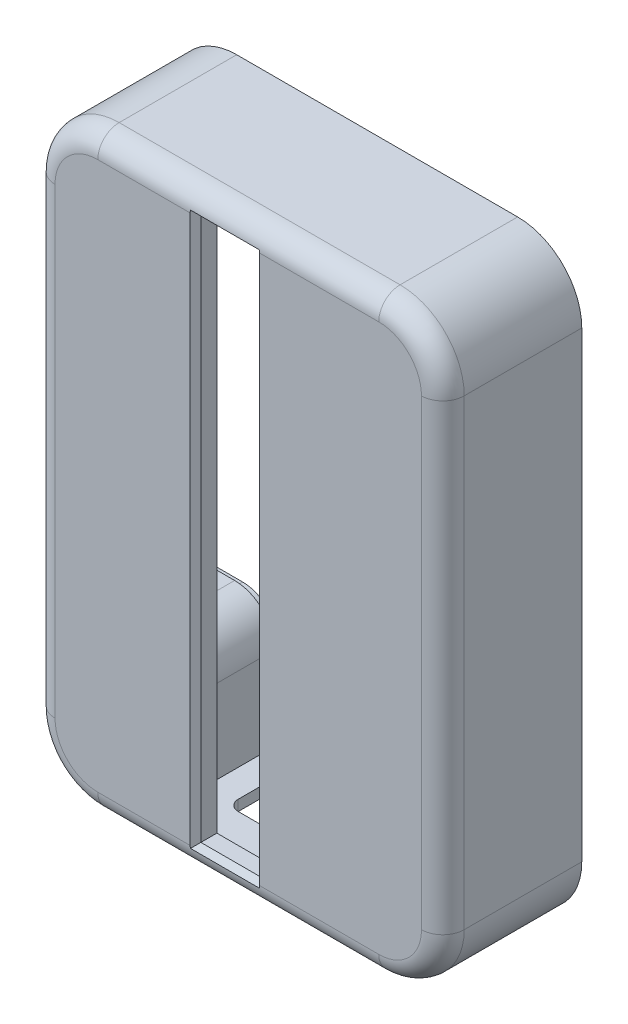
from build123d import *

# Parameters (mm, degrees)
BOSS_EXTRUDE1_DEPTH = 10
SKETCH12_W          = 1
SKETCH12_H          = 8.6
BOSS_EXTRUDE8_DEPTH = 5
BOSS_EXTRUDE5_DEPTH = 3
BOSS_EXTRUDE6_START = 10.75
SKETCH10_R          = 1.75
BOSS_EXTRUDE6_DEPTH = 10.75
SKETCH11_W          = 14.1
SKETCH11_H          = 1
BOSS_EXTRUDE7_DEPTH = 1.5
FILLET1_R           = 2
CUT_EXTRUDE2_REACH  = 69.377
SKETCH13_W          = 14
SKETCH13_H          = 7
FILLET2_R           = 1
SKETCH14_W          = 11
SKETCH14_H          = 53.26
CUT_EXTRUDE3_DEPTH  = 1
SKETCH15_W          = 5.5
SKETCH15_H          = 50.76
CUT_EXTRUDE4_DEPTH  = 64.095912704
SKETCH17_W          = 4
SKETCH17_H          = 5
SKETCH17_R          = 1
BOSS_EXTRUDE9_DEPTH = 1
CHAMFER1_SIZE       = 0.5
CUT_EXTRUDE5_START  = -1
SKETCH18_R          = 1
CUT_EXTRUDE5_DEPTH  = 1
CUT_EXTRUDE7_DEPTH  = 0.75


with BuildPart() as part:
    # Sketch1 → Boss-Extrude1 (new body)
    with BuildSketch(Plane.XY):
        with BuildLine():
            Line((-1, 27.44), (-1, 1))
            ThreePointArc((-1, 1), (0.464466094, -2.535533906), (4, -4))
            Line((4, -4), (30.29, -4))
            ThreePointArc((30.29, -4), (33.825533906, -2.535533906), (35.29, 1))
            Line((35.29, 1), (35.29, 44.26))
            ThreePointArc((35.29, 44.26), (33.825533906, 47.795533906), (30.29, 49.26))
            Line((30.29, 49.26), (4, 49.26))
            ThreePointArc((4, 49.26), (0.464466094, 47.795533906), (-1, 44.26))
            Line((-1, 44.26), (-1, 36.04))
            Line((-1, 36.04), (-2, 36.04))
            Line((-2, 36.04), (-2, 44.26))
            ThreePointArc((-2, 44.26), (-0.242640687, 48.502640687), (4, 50.26))
            Line((4, 50.26), (30.29, 50.26))
            ThreePointArc((30.29, 50.26), (34.532640687, 48.502640687), (36.29, 44.26))
            Line((36.29, 44.26), (36.29, 1))
            ThreePointArc((36.29, 1), (34.532640687, -3.242640687), (30.29, -5))
            Line((30.29, -5), (4, -5))
            ThreePointArc((4, -5), (-0.242640687, -3.242640687), (-2, 1))
            Line((-2, 1), (-2, 27.44))
            Line((-2, 27.44), (-1, 27.44))
        make_face()
    extrude(amount=BOSS_EXTRUDE1_DEPTH)

    # Sketch12 → Boss-Extrude8 (add)
    with BuildSketch(Plane.XY.offset(10)):
        with Locations((-1.5, 31.74)):
            Rectangle(SKETCH12_W, SKETCH12_H)
    extrude(amount=-BOSS_EXTRUDE8_DEPTH)

    # Sketch8 → Boss-Extrude5 (add)
    with BuildSketch(Plane.XY.offset(10)):
        with BuildLine():
            Line((-2, 44.26), (-2, 1))
            ThreePointArc((-2, 1), (-0.242640687, -3.242640687), (4, -5))
            Line((4, -5), (30.29, -5))
            ThreePointArc((30.29, -5), (34.532640687, -3.242640687), (36.29, 1))
            Line((36.29, 1), (36.29, 44.26))
            ThreePointArc((36.29, 44.26), (34.532640687, 48.502640687), (30.29, 50.26))
            Line((30.29, 50.26), (4, 50.26))
            ThreePointArc((4, 50.26), (-0.242640687, 48.502640687), (-2, 44.26))
        make_face()
    extrude(amount=BOSS_EXTRUDE5_DEPTH)

    # Sketch10 → Boss-Extrude6 (add)
    # profile 1 of 4: a face of its own
    with BuildSketch(Plane(origin=(0, 0, 10), x_dir=(-1, 0, 0), z_dir=(0, 0, -1)).offset(BOSS_EXTRUDE6_START)):
        with BuildLine():
            Line((-30.29, 49.26), (-26.73, 49.26))
            Line((-26.73, 49.26), (-26.73, 44.45))
            ThreePointArc((-26.73, 44.45), (-27.828349571, 41.798349571), (-30.48, 40.7))
            Line((-30.48, 40.7), (-35.29, 40.7))
            Line((-35.29, 40.7), (-35.29, 44.26))
            ThreePointArc((-35.29, 44.26), (-33.825533906, 47.795533906), (-30.29, 49.26))
        make_face()
        with Locations(Location((-30.48, 44.45, 0), (0, 0, 180))):
            Circle(SKETCH10_R, mode=Mode.SUBTRACT)
    # profile 2 of 4: a face of its own
    with BuildSketch(Plane(origin=(0, 0, 10), x_dir=(-1, 0, 0), z_dir=(0, 0, -1)).offset(BOSS_EXTRUDE6_START)):
        with BuildLine():
            Line((-3.81, 40.7), (1, 40.7))
            Line((1, 40.7), (1, 44.26))
            ThreePointArc((1, 44.26), (-0.464466094, 47.795533906), (-4, 49.26))
            Line((-4, 49.26), (-7.56, 49.26))
            Line((-7.56, 49.26), (-7.56, 44.45))
            ThreePointArc((-7.56, 44.45), (-6.461650429, 41.798349571), (-3.81, 40.7))
        make_face()
        with Locations(Location((-3.81, 44.45, 0), (0, 0, 180))):
            Circle(SKETCH10_R, mode=Mode.SUBTRACT)
    # profile 3 of 4: a face of its own
    with BuildSketch(Plane(origin=(0, 0, 10), x_dir=(-1, 0, 0), z_dir=(0, 0, -1)).offset(BOSS_EXTRUDE6_START)):
        with BuildLine():
            Line((1, 7.56), (1, 1))
            ThreePointArc((1, 1), (-0.464466094, -2.535533906), (-4, -4))
            Line((-4, -4), (-7.56, -4))
            Line((-7.56, -4), (-7.56, 3.81))
            ThreePointArc((-7.56, 3.81), (-6.461650429, 6.461650429), (-3.81, 7.56))
            Line((-3.81, 7.56), (1, 7.56))
        make_face()
        with Locations(Location((-3.81, 3.81, 0), (0, 0, 180))):
            Circle(SKETCH10_R, mode=Mode.SUBTRACT)
    # profile 4 of 4: a face of its own
    with BuildSketch(Plane(origin=(0, 0, 10), x_dir=(-1, 0, 0), z_dir=(0, 0, -1)).offset(BOSS_EXTRUDE6_START)):
        with BuildLine():
            Line((-26.73, -4), (-30.29, -4))
            ThreePointArc((-30.29, -4), (-33.825533906, -2.535533906), (-35.29, 1))
            Line((-35.29, 1), (-35.29, 7.56))
            Line((-35.29, 7.56), (-30.48, 7.56))
            ThreePointArc((-30.48, 7.56), (-27.828349571, 6.461650429), (-26.73, 3.81))
            Line((-26.73, 3.81), (-26.73, -4))
        make_face()
        with Locations(Location((-30.48, 3.81, 0), (0, 0, 180))):
            Circle(SKETCH10_R, mode=Mode.SUBTRACT)
    extrude(amount=-BOSS_EXTRUDE6_DEPTH)

    # Sketch11 → Boss-Extrude7 (add)
    with BuildSketch(Plane(origin=(0, 0, 10), x_dir=(-1, 0, 0), z_dir=(0, 0, -1))):
        with Locations((-17.145, -4.5)):
            Rectangle(SKETCH11_W, SKETCH11_H)
    extrude(amount=BOSS_EXTRUDE7_DEPTH)

    # Fillet1
    fillet1_edges = [part.edges().sort_by_distance(p)[0] for p in [
        (17.145, -5, 13),
        (36.29, 22.63, 13),
        (34.532640687, 48.502640687, 13),
        (17.145, 50.26, 13),
        (-0.242640687, 48.502640687, 13),
        (-2, 22.63, 13),
        (-0.242640687, -3.242640687, 13),
        (34.532640687, -3.242640687, 13),
    ]]
    fillet(fillet1_edges, radius=FILLET1_R)

    # Sketch13 → Cut-Extrude2 (cut, up to next)
    with BuildSketch(Plane.XZ.offset(5), mode=Mode.PRIVATE) as cut_extrude2_sk1:
        with Locations((17.145, 3.5)):
            Rectangle(SKETCH13_W, SKETCH13_H)
    cut_extrude2_tool1 = extrude(cut_extrude2_sk1.sketch, amount=-CUT_EXTRUDE2_REACH, mode=Mode.PRIVATE) & part.part
    add(cut_extrude2_tool1.solids().sort_by_distance((17.145, -5, 3.5))[0], mode=Mode.SUBTRACT)

    # Fillet2
    fillet2_edges = [part.edges().sort_by_distance(p)[0] for p in [
        (-1.5, 36.04, 5),
        (-1.5, 27.44, 5),
        (10.145, -4.5, 7),
        (24.145, -4.5, 7),
    ]]
    fillet(fillet2_edges, radius=FILLET2_R)

    # Sketch14 → Cut-Extrude3 (cut)
    with BuildSketch(Plane(origin=(0, 0, 10), x_dir=(-1, 0, 0), z_dir=(0, 0, -1))):
        with Locations((-17.145, 22.63)):
            Rectangle(SKETCH14_W, SKETCH14_H)
    extrude(amount=-CUT_EXTRUDE3_DEPTH, mode=Mode.SUBTRACT)

    # Sketch15 → Cut-Extrude4 (cut, through all)
    with BuildSketch(Plane(origin=(0, 0, 11), x_dir=(-1, 0, 0), z_dir=(0, 0, -1))):
        with Locations((-15.895, 22.63)):
            Rectangle(SKETCH15_W, SKETCH15_H)
    extrude(amount=-CUT_EXTRUDE4_DEPTH, mode=Mode.SUBTRACT)

    # Sketch17 → Boss-Extrude9 (add)
    # profile 1 of 2: a face of its own
    with BuildSketch(Plane(origin=(0, 0, 11), x_dir=(-1, 0, 0), z_dir=(0, 0, -1))):
        with Locations((-20.645, 10.36)):
            Rectangle(SKETCH17_W, SKETCH17_H)
        with Locations((-20.145, 10.36)):
            Circle(SKETCH17_R, mode=Mode.SUBTRACT)
    # profile 2 of 2: a face of its own
    with BuildSketch(Plane(origin=(0, 0, 11), x_dir=(-1, 0, 0), z_dir=(0, 0, -1))):
        with Locations((-20.645, 35.76)):
            Rectangle(SKETCH17_W, SKETCH17_H)
        with Locations((-20.145, 35.76)):
            Circle(SKETCH17_R, mode=Mode.SUBTRACT)
    extrude(amount=BOSS_EXTRUDE9_DEPTH)

    # Chamfer1
    # the kernel refuses this chamfer: 0.5 mm, written as the material it takes off along each edge
    with BuildSketch(Plane(origin=(13.145, 48.01, 13), x_dir=(-0.9996219169112968, 0, 0.027495876610585647), z_dir=(0, -1, 0)), Plane(origin=(18.645, -2.75, 13), x_dir=(0.9996219169112968, 0, 0.02749587661058555), z_dir=(0, 1, 0))) as chamfer1_piece_1:
        Polygon((CHAMFER1_SIZE * 0.999621916911, CHAMFER1_SIZE * 0.0274958766106), (-CHAMFER1_SIZE * 0.0274958766106, CHAMFER1_SIZE * 0.999621916911), (0, 0), align=None)
    extrude(amount=50.76, mode=Mode.SUBTRACT)
    with BuildSketch(Plane(origin=(13.145, -2.75, 13), x_dir=(0, -0.9996219169112968, 0.0274958766105856), z_dir=(1, 0, 0)), Plane(origin=(18.645, 48.01, 13), x_dir=(0, 0.9996219169112968, 0.02749587661058574), z_dir=(-1, 0, 0))) as chamfer1_piece_2:
        Polygon((CHAMFER1_SIZE * 0.999621916911, CHAMFER1_SIZE * 0.0274958766106), (-CHAMFER1_SIZE * 0.0274958766106, CHAMFER1_SIZE * 0.999621916911), (0, 0), align=None)
    extrude(amount=5.5, mode=Mode.SUBTRACT)
    with BuildSketch(Plane(origin=(18.645, 48.01, 13), x_dir=(0, 0.9996219169112968, 0.02749587661058574), z_dir=(-1, 0, 0))) as chamfer1_piece_3a_section:
        Polygon((CHAMFER1_SIZE * 0.999621916911, CHAMFER1_SIZE * 0.0274958766106), (-CHAMFER1_SIZE * 0.0274958766106, CHAMFER1_SIZE * 0.999621916911), (0, 0), align=None)
    chamfer1_piece_3a = extrude(amount=6.785841494, mode=Mode.PRIVATE)
    chamfer1_piece_3a = split(chamfer1_piece_3a, bisect_by=Plane(origin=(13.145, 48.174896813, 12.835103187), z_dir=(-1, 0, 0)), keep=Keep.TOP, mode=Mode.PRIVATE)
    with BuildSketch(Plane(origin=(13.145, 49.295841494, 13), x_dir=(-0.9996219169112968, 0, 0.027495876610585647), z_dir=(0, -1, 0))) as chamfer1_piece_3b_section:
        Polygon((CHAMFER1_SIZE * 0.999621916911, CHAMFER1_SIZE * 0.0274958766106), (-CHAMFER1_SIZE * 0.0274958766106, CHAMFER1_SIZE * 0.999621916911), (0, 0), align=None)
    chamfer1_piece_3b = extrude(amount=52.045841494, mode=Mode.PRIVATE)
    chamfer1_piece_3b = split(chamfer1_piece_3b, bisect_by=Plane(origin=(12.980103187, 48.01, 12.835103187), z_dir=(0, 1, 0)), keep=Keep.TOP, mode=Mode.PRIVATE)
    chamfer1_piece_3 = chamfer1_piece_3a & chamfer1_piece_3b
    add(chamfer1_piece_3, mode=Mode.SUBTRACT)
    with BuildSketch(Plane(origin=(13.145, 48.01, 13), x_dir=(-0.9996219169112968, 0, 0.027495876610585647), z_dir=(0, -1, 0))) as chamfer1_piece_4a_section:
        Polygon((CHAMFER1_SIZE * 0.999621916911, CHAMFER1_SIZE * 0.0274958766106), (-CHAMFER1_SIZE * 0.0274958766106, CHAMFER1_SIZE * 0.999621916911), (0, 0), align=None)
    chamfer1_piece_4a = extrude(amount=52.045841494, mode=Mode.PRIVATE)
    chamfer1_piece_4a = split(chamfer1_piece_4a, bisect_by=Plane(origin=(12.980103187, -2.75, 12.835103187), z_dir=(0, -1, 0)), keep=Keep.TOP, mode=Mode.PRIVATE)
    with BuildSketch(Plane(origin=(11.859158506, -2.75, 13), x_dir=(0, -0.9996219169112968, 0.027495876610585623), z_dir=(1, 0, 0))) as chamfer1_piece_4b_section:
        Polygon((CHAMFER1_SIZE * 0.999621916911, CHAMFER1_SIZE * 0.0274958766106), (-CHAMFER1_SIZE * 0.0274958766106, CHAMFER1_SIZE * 0.999621916911), (0, 0), align=None)
    chamfer1_piece_4b = extrude(amount=6.785841494, mode=Mode.PRIVATE)
    chamfer1_piece_4b = split(chamfer1_piece_4b, bisect_by=Plane(origin=(13.145, -2.914896813, 12.835103187), z_dir=(-1, 0, 0)), keep=Keep.TOP, mode=Mode.PRIVATE)
    chamfer1_piece_4 = chamfer1_piece_4a & chamfer1_piece_4b
    add(chamfer1_piece_4, mode=Mode.SUBTRACT)
    with BuildSketch(Plane(origin=(13.145, -2.75, 13), x_dir=(0, -0.9996219169112968, 0.0274958766105856), z_dir=(1, 0, 0))) as chamfer1_piece_5a_section:
        Polygon((CHAMFER1_SIZE * 0.999621916911, CHAMFER1_SIZE * 0.0274958766106), (-CHAMFER1_SIZE * 0.0274958766106, CHAMFER1_SIZE * 0.999621916911), (0, 0), align=None)
    chamfer1_piece_5a = extrude(amount=6.785841494, mode=Mode.PRIVATE)
    chamfer1_piece_5a = split(chamfer1_piece_5a, bisect_by=Plane(origin=(18.645, -2.914896813, 12.835103187), z_dir=(1, 0, 0)), keep=Keep.TOP, mode=Mode.PRIVATE)
    with BuildSketch(Plane(origin=(18.645, -4.035841494, 13), x_dir=(0.9996219169112968, 0, 0.02749587661058555), z_dir=(0, 1, 0))) as chamfer1_piece_5b_section:
        Polygon((CHAMFER1_SIZE * 0.999621916911, CHAMFER1_SIZE * 0.0274958766106), (-CHAMFER1_SIZE * 0.0274958766106, CHAMFER1_SIZE * 0.999621916911), (0, 0), align=None)
    chamfer1_piece_5b = extrude(amount=52.045841494, mode=Mode.PRIVATE)
    chamfer1_piece_5b = split(chamfer1_piece_5b, bisect_by=Plane(origin=(18.809896813, -2.75, 12.835103187), z_dir=(0, -1, 0)), keep=Keep.TOP, mode=Mode.PRIVATE)
    chamfer1_piece_5 = chamfer1_piece_5a & chamfer1_piece_5b
    add(chamfer1_piece_5, mode=Mode.SUBTRACT)
    with BuildSketch(Plane(origin=(19.930841494, 48.01, 13), x_dir=(0, 0.9996219169112968, 0.02749587661058574), z_dir=(-1, 0, 0))) as chamfer1_piece_6a_section:
        Polygon((CHAMFER1_SIZE * 0.999621916911, CHAMFER1_SIZE * 0.0274958766106), (-CHAMFER1_SIZE * 0.0274958766106, CHAMFER1_SIZE * 0.999621916911), (0, 0), align=None)
    chamfer1_piece_6a = extrude(amount=6.785841494, mode=Mode.PRIVATE)
    chamfer1_piece_6a = split(chamfer1_piece_6a, bisect_by=Plane(origin=(18.645, 48.174896813, 12.835103187), z_dir=(1, 0, 0)), keep=Keep.TOP, mode=Mode.PRIVATE)
    with BuildSketch(Plane(origin=(18.645, -2.75, 13), x_dir=(0.9996219169112968, 0, 0.02749587661058555), z_dir=(0, 1, 0))) as chamfer1_piece_6b_section:
        Polygon((CHAMFER1_SIZE * 0.999621916911, CHAMFER1_SIZE * 0.0274958766106), (-CHAMFER1_SIZE * 0.0274958766106, CHAMFER1_SIZE * 0.999621916911), (0, 0), align=None)
    chamfer1_piece_6b = extrude(amount=52.045841494, mode=Mode.PRIVATE)
    chamfer1_piece_6b = split(chamfer1_piece_6b, bisect_by=Plane(origin=(18.809896813, 48.01, 12.835103187), z_dir=(0, 1, 0)), keep=Keep.TOP, mode=Mode.PRIVATE)
    chamfer1_piece_6 = chamfer1_piece_6a & chamfer1_piece_6b
    add(chamfer1_piece_6, mode=Mode.SUBTRACT)

    # Sketch18 → Cut-Extrude5 (cut)
    with BuildSketch(Plane(origin=(0, 0, 11), x_dir=(-1, 0, 0), z_dir=(0, 0, -1)).offset(CUT_EXTRUDE5_START)):
        with Locations((-20.145, 10.36)):
            Circle(SKETCH18_R)
        with Locations((-20.145, 35.76)):
            Circle(SKETCH18_R)
    extrude(amount=CUT_EXTRUDE5_DEPTH, mode=Mode.SUBTRACT)

    # Sketch19 → Cut-Extrude7 (cut)
    # profile 1 of 4: a face of its own
    with BuildSketch(Plane(origin=(0, 0, -0.75), x_dir=(-1, 0, 0), z_dir=(0, 0, -1))):
        with BuildLine():
            Line((-25.23, 50.76), (-30.29, 50.76))
            ThreePointArc((-30.29, 50.76), (-34.886194078, 48.856194078), (-36.79, 44.26))
            Line((-36.79, 44.26), (-36.79, 39.2))
            Line((-36.79, 39.2), (-30.48, 39.2))
            ThreePointArc((-30.48, 39.2), (-26.767689399, 40.737689399), (-25.23, 44.45))
            Line((-25.23, 44.45), (-25.23, 50.76))
        make_face()
        with BuildLine():
            Line((-27.23, 48.76), (-30.29, 48.76))
            ThreePointArc((-30.29, 48.76), (-33.471980515, 47.441980515), (-34.79, 44.26))
            Line((-34.79, 44.26), (-34.79, 41.2))
            Line((-34.79, 41.2), (-30.48, 41.2))
            ThreePointArc((-30.48, 41.2), (-28.181902961, 42.151902961), (-27.23, 44.45))
            Line((-27.23, 44.45), (-27.23, 48.76))
        make_face(mode=Mode.SUBTRACT)
    # profile 2 of 4: a face of its own
    with BuildSketch(Plane(origin=(0, 0, -0.75), x_dir=(-1, 0, 0), z_dir=(0, 0, -1))):
        with BuildLine():
            Line((-4, 50.76), (-9.06, 50.76))
            Line((-9.06, 50.76), (-9.06, 44.45))
            ThreePointArc((-9.06, 44.45), (-7.522310601, 40.737689399), (-3.81, 39.2))
            Line((-3.81, 39.2), (2.5, 39.2))
            Line((2.5, 39.2), (2.5, 44.26))
            ThreePointArc((2.5, 44.26), (0.596194078, 48.856194078), (-4, 50.76))
        make_face()
        with BuildLine():
            Line((-4, 48.76), (-7.06, 48.76))
            Line((-7.06, 48.76), (-7.06, 44.45))
            ThreePointArc((-7.06, 44.45), (-6.108097039, 42.151902961), (-3.81, 41.2))
            Line((-3.81, 41.2), (0.5, 41.2))
            Line((0.5, 41.2), (0.5, 44.26))
            ThreePointArc((0.5, 44.26), (-0.818019485, 47.441980515), (-4, 48.76))
        make_face(mode=Mode.SUBTRACT)
    # profile 3 of 4: a face of its own
    with BuildSketch(Plane(origin=(0, 0, -0.75), x_dir=(-1, 0, 0), z_dir=(0, 0, -1))):
        with BuildLine():
            Line((-30.29, -5.5), (-25.23, -5.5))
            Line((-25.23, -5.5), (-25.23, 3.81))
            ThreePointArc((-25.23, 3.81), (-26.767689399, 7.522310601), (-30.48, 9.06))
            Line((-30.48, 9.06), (-36.79, 9.06))
            Line((-36.79, 9.06), (-36.79, 1))
            ThreePointArc((-36.79, 1), (-34.886194078, -3.596194078), (-30.29, -5.5))
        make_face()
        with BuildLine():
            Line((-30.29, -3.5), (-27.23, -3.5))
            Line((-27.23, -3.5), (-27.23, 3.81))
            ThreePointArc((-27.23, 3.81), (-28.181902961, 6.108097039), (-30.48, 7.06))
            Line((-30.48, 7.06), (-34.79, 7.06))
            Line((-34.79, 7.06), (-34.79, 1))
            ThreePointArc((-34.79, 1), (-33.471980515, -2.181980515), (-30.29, -3.5))
        make_face(mode=Mode.SUBTRACT)
    # profile 4 of 4: a face of its own
    with BuildSketch(Plane(origin=(0, 0, -0.75), x_dir=(-1, 0, 0), z_dir=(0, 0, -1))):
        with BuildLine():
            Line((-9.06, -5.5), (-4, -5.5))
            ThreePointArc((-4, -5.5), (0.596194078, -3.596194078), (2.5, 1))
            Line((2.5, 1), (2.5, 9.06))
            Line((2.5, 9.06), (-3.81, 9.06))
            ThreePointArc((-3.81, 9.06), (-7.522310601, 7.522310601), (-9.06, 3.81))
            Line((-9.06, 3.81), (-9.06, -5.5))
        make_face()
        with BuildLine():
            Line((-7.06, -3.5), (-4, -3.5))
            ThreePointArc((-4, -3.5), (-0.818019485, -2.181980515), (0.5, 1))
            Line((0.5, 1), (0.5, 7.06))
            Line((0.5, 7.06), (-3.81, 7.06))
            ThreePointArc((-3.81, 7.06), (-6.108097039, 6.108097039), (-7.06, 3.81))
            Line((-7.06, 3.81), (-7.06, -3.5))
        make_face(mode=Mode.SUBTRACT)
    extrude(amount=-CUT_EXTRUDE7_DEPTH, mode=Mode.SUBTRACT)


solid = part.part
